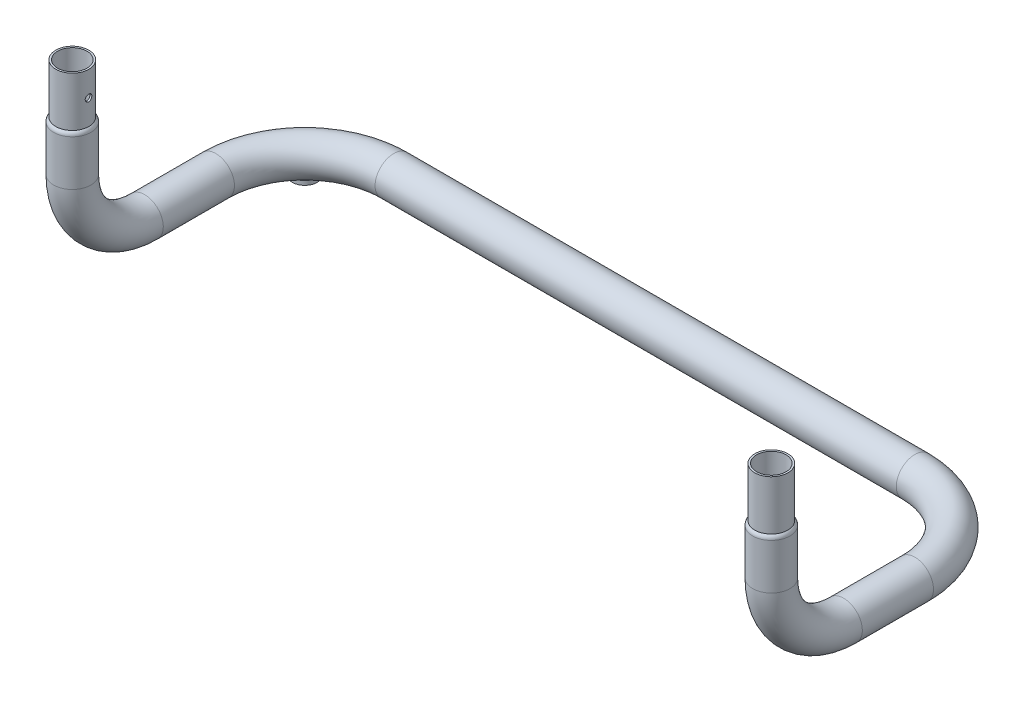
from build123d import *

# Parameters (mm, degrees)
SKETCH1_R                     = 11.25
SKETCH1_R_2                   = 10.15
SKETCH2_R                     = 11.25
SKETCH2_R_2                   = 8.9
BOSS_EXTRUDE1_DEPTH           = 1.1
BOSS_EXTRUDE2_START           = 30
SKETCH3_R                     = 10
SKETCH3_R_2                   = 8.9
BOSS_EXTRUDE2_DEPTH           = 30
FILLET1_R                     = 3
CUT_EXTRUDE1_REACH            = 300.831
CUT_EXTRUDE1_END_MAJOR_RADIUS = 53.75
CUT_EXTRUDE1_END_MINOR_RADIUS = 10.15
SKETCH4_R                     = 5
SKETCH5_R                     = 7.5
SKETCH5_R_2                   = 4.75
BOSS_EXTRUDE3_DEPTH           = 2.5
SKETCH6_R                     = 2
CUT_EXTRUDE2_DEPTH            = 2.5


with BuildPart() as part:
    # Sweep1: sweep along a curve in space
    with BuildLine() as sweep1_path:
        Line((222.5, 55, 163), (222.5, 85, 163))
        ThreePointArc((222.5, 0, 108), (222.5, 16.109127035, 146.890872965), (222.5, 55, 163))
        Line((222.5, 0, 65), (222.5, 0, 108))
        ThreePointArc((157.5, 0, 0), (203.461940777, 0, 19.038059223), (222.5, 0, 65))
        Line((-157.5, 0, 0), (157.5, 0, 0))
        ThreePointArc((-222.5, 0, 65), (-203.461940777, 0, 19.038059223), (-157.5, 0, 0))
        Line((-222.5, 0, 65), (-222.5, 0, 108))
        ThreePointArc((-222.5, 55, 163), (-222.5, 16.109127035, 146.890872965), (-222.5, 0, 108))
        Line((-222.5, 55, 163), (-222.5, 85, 163))
    # Sketch1 → Sweep1 (sweep)
    with BuildSketch(Plane(origin=(0, 85, 0), x_dir=(1, 0, 0), z_dir=(0, 1, 0))):
        with Locations((211.25, -151.75)):
            Circle(SKETCH1_R)
        with Locations((211.25, -151.75)):
            Circle(SKETCH1_R_2, mode=Mode.SUBTRACT)
    sweep(path=sweep1_path.line)

    # Sketch2 → Boss-Extrude1 (add)
    with BuildSketch(Plane(origin=(0, 85, 0), x_dir=(1, 0, 0), z_dir=(0, 1, 0))):
        with Locations(Location((211.25, -151.75, 0), (0, 0, 270))):
            Circle(SKETCH2_R)
        with Locations(Location((211.25, -151.75, 0), (0, 0, 270))):
            Circle(SKETCH2_R_2, mode=Mode.SUBTRACT)
    boss_extrude1 = extrude(amount=-BOSS_EXTRUDE1_DEPTH)

    # Sketch3 → Boss-Extrude2 (add)
    with BuildSketch(Plane(origin=(0, 85, 0), x_dir=(1, 0, 0), z_dir=(0, 1, 0)).offset(BOSS_EXTRUDE2_START)):
        with Locations(Location((211.25, -151.75, 0), (0, 0, 270))):
            Circle(SKETCH3_R)
        with Locations(Location((211.25, -151.75, 0), (0, 0, 270))):
            Circle(SKETCH3_R_2, mode=Mode.SUBTRACT)
    boss_extrude2 = extrude(amount=-BOSS_EXTRUDE2_DEPTH)

    # Mirror7: Boss-Extrude1, Boss-Extrude2 across plane
    add(boss_extrude1.mirror(Plane(origin=(0, 0, 0), x_dir=(0, 0, 1), z_dir=(1, 0, 0))))
    add(boss_extrude2.mirror(Plane(origin=(0, 0, 0), x_dir=(0, 0, 1), z_dir=(1, 0, 0))))

    # Fillet1
    # the kernel refuses this fillet: 3 mm, written as the material it adds along each edge
    with BuildSketch(Plane(origin=(211.25, 83.9, 151.75), x_dir=(1, 0, 0), z_dir=(0, 0, 1))) as fillet1_piece_1:
        with BuildLine():
            CenterArc((7.15, -2.436698586), FILLET1_R, 0, 54.314665287)
            Line((8.9, 0), (8.935, 0.048733972))
            ThreePointArc((8.935, 0.048733972), (9.525, 0.06), (10.15, 0.06))
            Line((10.15, 0.06), (10.21, 0))
            Line((10.21, 0), (10.21, -2.436698586))
            Line((10.21, -2.436698586), (10.15, -2.436698586))
        make_face()
    revolve(axis=Axis((211.25, 83.9, 151.75), (0, 1, 0)))
    with BuildSketch(Plane(origin=(-211.25, 83.9, 151.75), x_dir=(-1, 0, 0), z_dir=(0, 0, 1))) as fillet1_piece_2:
        with BuildLine():
            CenterArc((7.15, 2.436698586), FILLET1_R, 305.685334713, 54.314665287)
            Line((10.15, 2.436698586), (10.21, 2.436698586))
            Line((10.21, 2.436698586), (10.21, 0))
            Line((10.21, 0), (10.15, -0.06))
            ThreePointArc((10.15, -0.06), (9.525, -0.06), (8.935, -0.048733972))
            Line((8.935, -0.048733972), (8.9, 0))
        make_face()
    revolve(axis=Axis((-211.25, 83.9, 151.75), (0, -1, 0)))
    # the kernel refuses this fillet: 3 mm, written as the material it takes off along each edge
    with BuildSketch(Plane(origin=(-211.25, 85, 151.75), x_dir=(-1, 0, 0), z_dir=(0, 0, 1))) as fillet1_2_piece_1:
        with BuildLine():
            CenterArc((8.25, 2.436698586), FILLET1_R, 305.685334713, 54.314665287)
            Line((10, 0), (10.035, -0.048733972))
            ThreePointArc((10.035, -0.048733972), (10.625, -0.06), (11.25, -0.06))
            Line((11.25, -0.06), (11.31, 0))
            Line((11.31, 0), (11.31, 2.436698586))
            Line((11.31, 2.436698586), (11.25, 2.436698586))
        make_face()
    revolve(axis=Axis((-211.25, 85, 151.75), (0, -1, 0)), mode=Mode.SUBTRACT)
    with BuildSketch(Plane(origin=(211.25, 85, 151.75), x_dir=(1, 0, 0), z_dir=(0, 0, -1))) as fillet1_2_piece_2:
        with BuildLine():
            CenterArc((8.25, 2.436698586), FILLET1_R, 305.685334713, 54.314665287)
            Line((10, 0), (10.035, -0.048733972))
            ThreePointArc((10.035, -0.048733972), (10.625, -0.06), (11.25, -0.06))
            Line((11.25, -0.06), (11.31, 0))
            Line((11.31, 0), (11.31, 2.436698586))
            Line((11.31, 2.436698586), (11.25, 2.436698586))
        make_face()
    revolve(axis=Axis((211.25, 85, 151.75), (0, -1, 0)), mode=Mode.SUBTRACT)

    # Cut-Extrude1: up to this torus (the profile starts outside it)
    cut_extrude1_end = Plane(origin=(157.5, 11.25, 65), z_dir=(0, -1, 0)) * Torus(CUT_EXTRUDE1_END_MAJOR_RADIUS, CUT_EXTRUDE1_END_MINOR_RADIUS, mode=Mode.PRIVATE)
    # Sketch4 → Cut-Extrude1 (cut, up to the surface)
    with BuildSketch(Plane(origin=(0, 0, 0), x_dir=(1, 0, 0), z_dir=(0, 1, 0)), mode=Mode.PRIVATE) as cut_extrude1_sk1:
        with Locations(Location((195.506989489, -26.993010511, 0), (0, 0, 312.334118917))):
            Circle(SKETCH4_R)
    cut_extrude1_tool1 = extrude(cut_extrude1_sk1.sketch, amount=CUT_EXTRUDE1_REACH, mode=Mode.PRIVATE) - cut_extrude1_end
    cut_extrude1 = cut_extrude1_tool1.solids().sort_by_distance((195.506989, 0, 26.993011))[0]
    add(cut_extrude1, mode=Mode.SUBTRACT)

    # Sketch5 → Boss-Extrude3 (add)
    with BuildSketch(Plane(origin=(0, 0, 0), x_dir=(1, 0, 0), z_dir=(0, 1, 0))):
        with Locations((195.506989489, -26.993010511)):
            Circle(SKETCH5_R)
        with Locations(Location((195.506989489, -26.993010511, 0), (0, 0, 270))):
            Circle(SKETCH5_R_2, mode=Mode.SUBTRACT)
    boss_extrude3 = extrude(amount=BOSS_EXTRUDE3_DEPTH)

    # Sketch6 → Cut-Extrude2 (cut)
    with BuildSketch(Plane.ZY.offset(-201.25)):
        with Locations((151.75, 100)):
            Circle(SKETCH6_R)
    cut_extrude2 = extrude(amount=-CUT_EXTRUDE2_DEPTH, mode=Mode.SUBTRACT)

    # Mirror8: Cut-Extrude1, Boss-Extrude3, Cut-Extrude2 across plane
    add(cut_extrude1.mirror(Plane(origin=(0, 0, 0), x_dir=(0, 0, 1), z_dir=(1, 0, 0))), mode=Mode.SUBTRACT)
    add(boss_extrude3.mirror(Plane(origin=(0, 0, 0), x_dir=(0, 0, 1), z_dir=(1, 0, 0))))
    add(cut_extrude2.mirror(Plane(origin=(0, 0, 0), x_dir=(0, 0, 1), z_dir=(1, 0, 0))), mode=Mode.SUBTRACT)


solid = part.part
